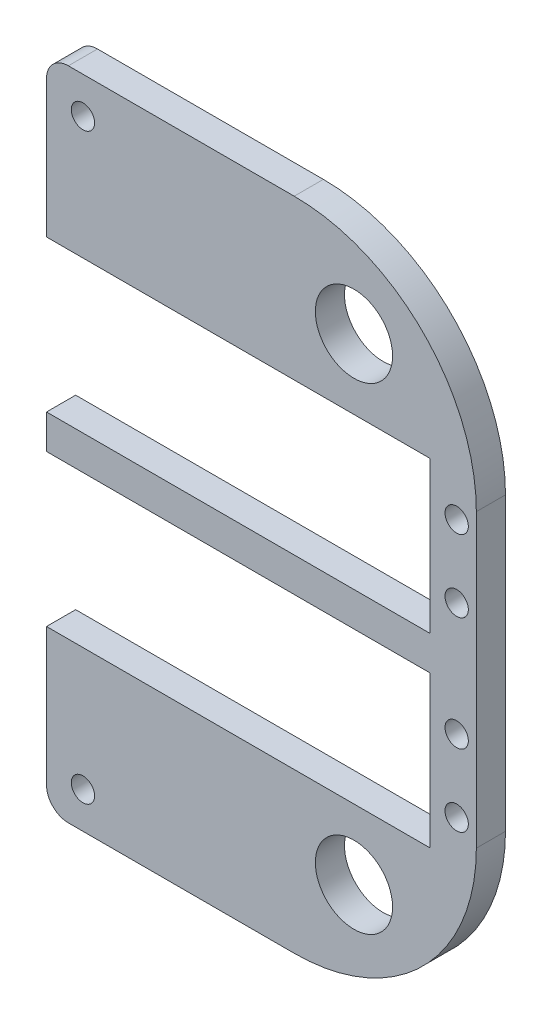
from build123d import *

# Parameters (mm, degrees)
SKETCH_1_R          = 5.3
SKETCH_1_R_2        = 1.6
EXTRUDE_1_DEPTH     = 4
FILLET_1_R          = 3
FILLET_2_R          = 25
SKETCH_2_R          = 1.6
CUT_EXTRUDE_1_DEPTH = 10


with BuildPart() as part:
    # ｽｹｯﾁ1 → ﾎﾞｽ - 押し出し1 (new body)
    with BuildSketch(Plane.XY):
        Polygon((-32, -10.4), (-32, -32.25), (27, -32.25), (27, 57.75), (-32, 57.75), (-32, 35.9), (20.65, 35.9), (20.65, 15.1), (-32, 15.1), (-32, 10.4), (20.65, 10.4), (20.65, -10.4), align=None)
        with Locations((10.2, -20)):
            Circle(SKETCH_1_R, mode=Mode.SUBTRACT)
        with Locations((24.3, -4.95)):
            Circle(SKETCH_1_R_2, mode=Mode.SUBTRACT)
        with Locations((24.3, 4.95)):
            Circle(SKETCH_1_R_2, mode=Mode.SUBTRACT)
        with Locations((24.3, 20.55)):
            Circle(SKETCH_1_R_2, mode=Mode.SUBTRACT)
        with Locations((24.3, 30.45)):
            Circle(SKETCH_1_R_2, mode=Mode.SUBTRACT)
        with Locations((10.2, 45.5)):
            Circle(SKETCH_1_R, mode=Mode.SUBTRACT)
    extrude(amount=EXTRUDE_1_DEPTH)

    # ﾌｨﾚｯﾄ1
    fillet_1_edges = [part.edges().sort_by_distance(p)[0] for p in [
        (-32, 57.75, 2),
        (-32, -32.25, 2),
    ]]
    fillet(fillet_1_edges, radius=FILLET_1_R)

    # ﾌｨﾚｯﾄ2
    fillet_2_edges = [part.edges().sort_by_distance(p)[0] for p in [
        (27, 57.75, 2),
        (27, -32.25, 2),
    ]]
    fillet(fillet_2_edges, radius=FILLET_2_R)

    # ｽｹｯﾁ2 → ｶｯﾄ - 押し出し1 (cut)
    with BuildSketch(Plane(origin=(0, 0, 0), x_dir=(-1, 0, 0), z_dir=(0, 0, -1))):
        with Locations((27, 52.75)):
            Circle(SKETCH_2_R)
        with Locations((27, -27.25)):
            Circle(SKETCH_2_R)
    extrude(amount=-CUT_EXTRUDE_1_DEPTH, mode=Mode.SUBTRACT)


solid = part.part
